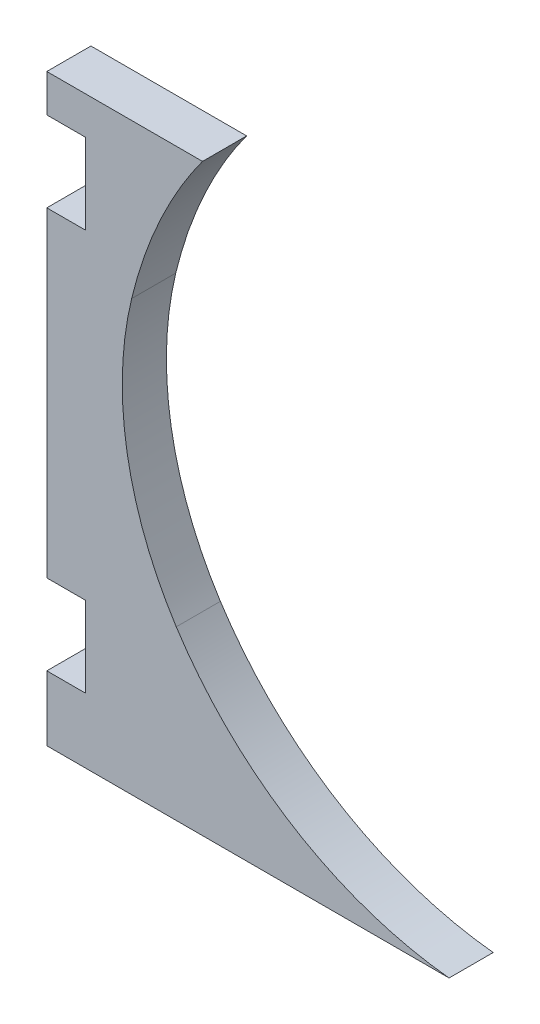
from build123d import *

# Parameters (mm, degrees)
SKETCH1_W           = 140
SKETCH1_H           = 225
BOSS_EXTRUDE1_DEPTH = 17
CUT_EXTRUDE1_DEPTH  = 134.586114548
FILLET1_R           = 130
SKETCH3_W           = 17
SKETCH3_H           = 225
BOSS_EXTRUDE2_DEPTH = 15
SKETCH4_W           = 15
SKETCH4_H           = 31
CUT_EXTRUDE3_DEPTH  = 143.022005488


with BuildPart() as part:
    # Sketch1 → Boss-Extrude1 (new body)
    with BuildSketch(Plane.XY):
        Rectangle(SKETCH1_W, SKETCH1_H)
    extrude(amount=BOSS_EXTRUDE1_DEPTH)

    # Sketch2 → Cut-Extrude1 (cut, through all)
    with BuildSketch(Plane.XY.offset(17)):
        with BuildLine():
            Line((70, 112.5), (-25, 112.5))
            add(Edge.make_bspline(
                [(-57, 12.829167661), (-57.230920503, 51.908636371), (-43.499555568, 87.434937954), (-25, 112.5)],
                knots=[0, 0, 0, 0, 1, 1, 1, 1], degree=3))
            ThreePointArc((-57, 12.829167661), (-15.444512377, -72.072482958), (70, -112.5))
            Line((70, -112.5), (70, 112.5))
        make_face()
    extrude(amount=-CUT_EXTRUDE1_DEPTH, mode=Mode.SUBTRACT)

    # Fillet1
    fillet1_edges = [part.edges().sort_by_distance(p)[0] for p in [
        (-57, 12.829167661, 8.5),
    ]]
    fillet(fillet1_edges, radius=FILLET1_R)

    # Sketch3 → Boss-Extrude2 (add)
    with BuildSketch(Plane.ZY.offset(70)):
        with Locations((8.5, 0)):
            Rectangle(SKETCH3_W, SKETCH3_H)
    extrude(amount=BOSS_EXTRUDE2_DEPTH)

    # Sketch4 → Cut-Extrude3 (cut, through all)
    with BuildSketch(Plane(origin=(0, 0, 0), x_dir=(-1, 0, 0), z_dir=(0, 0, -1))):
        with Locations((77.5, 82.5)):
            Rectangle(SKETCH4_W, SKETCH4_H)
        with Locations((77.5, -72)):
            Rectangle(SKETCH4_W, SKETCH4_H)
    extrude(amount=-CUT_EXTRUDE3_DEPTH, mode=Mode.SUBTRACT)


solid = part.part
